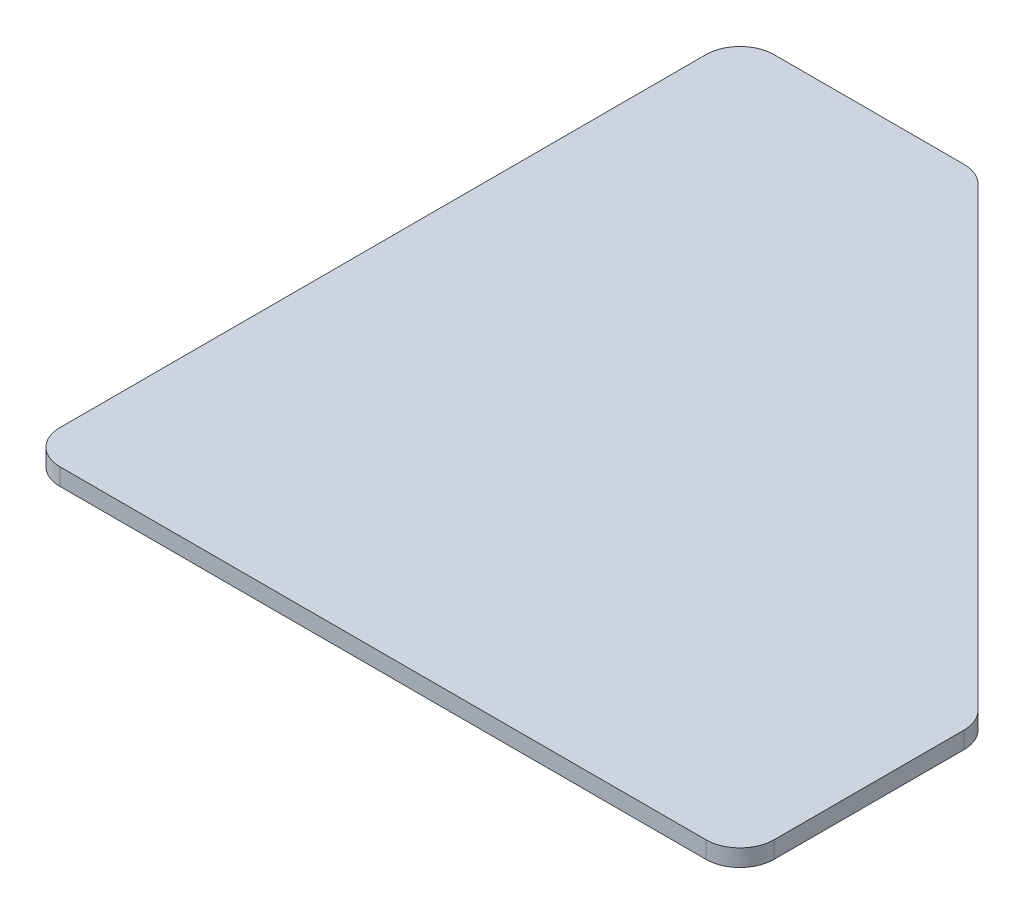
from build123d import *

# Parameters (mm, degrees)
BOSS_EXTRUDE1_DEPTH = 3.175
FILLET1_R           = 6.35


with BuildPart() as part:
    # Sketch1 → Boss-Extrude1 (new body)
    with BuildSketch(Plane(origin=(0, 0, 0), x_dir=(1, 0, 0), z_dir=(0, 1, 0))):
        Polygon((0, 0), (0, 133.35), (44.45, 133.35), (133.35, 44.45), (133.35, 0), align=None)
    extrude(amount=BOSS_EXTRUDE1_DEPTH)

    # Fillet1
    fillet1_edges = [part.edges().sort_by_distance(p)[0] for p in [
        (0, 1.5875, -133.35),
        (44.45, 1.5875, -133.35),
        (133.35, 1.5875, -44.45),
        (133.35, 1.5875, 0),
        (0, 1.5875, 0),
    ]]
    fillet(fillet1_edges, radius=FILLET1_R)


solid = part.part
